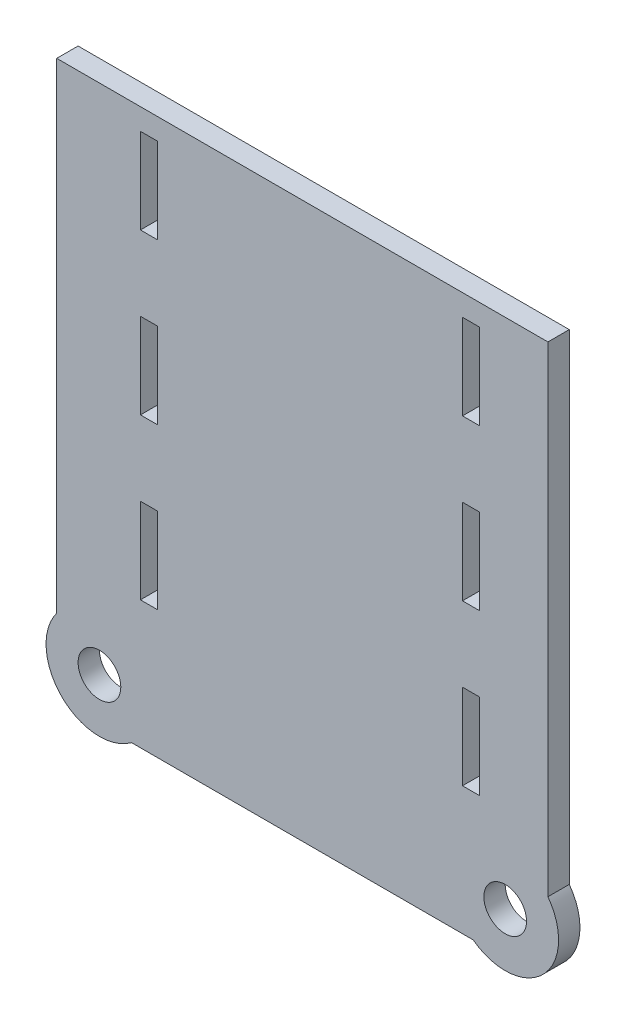
from build123d import *

# Parameters (mm, degrees)
SKETCH1_R           = 6.35
BOSS_EXTRUDE1_DEPTH = 3.175
SKETCH2_W           = 5.08
SKETCH2_H           = 25.4
CUT_EXTRUDE1_DEPTH  = 171.506664093


with BuildPart() as part:
    # Sketch1 → Boss-Extrude1 (new, symmetric)
    with BuildSketch(Plane.XY):
        with BuildLine():
            Line((-0.002676144, -12.7), (0.002676144, -12.7))
            Line((0.002676144, -12.7), (50.8, -12.7))
            ThreePointArc((50.8, -12.7), (71.550320151, -11.225320151), (73.025, 9.525))
            Line((73.025, 9.525), (73.025, 152.4))
            Line((73.025, 152.4), (-73.025, 152.4))
            Line((-73.025, 152.4), (-73.025, 9.525))
            ThreePointArc((-73.025, 9.525), (-71.550320151, -11.225320151), (-50.8, -12.7))
            Line((-50.8, -12.7), (-0.002676144, -12.7))
        make_face()
        with Locations((-60.325, 0)):
            Circle(SKETCH1_R, mode=Mode.SUBTRACT)
        with Locations((60.325, 0)):
            Circle(SKETCH1_R, mode=Mode.SUBTRACT)
    extrude(amount=BOSS_EXTRUDE1_DEPTH, both=True)

    # Sketch2 → Cut-Extrude1 (cut, through all)
    with BuildSketch(Plane.XY.offset(3.175)):
        with Locations((-45.593, 133.35)):
            Rectangle(SKETCH2_W, SKETCH2_H)
        with Locations((-45.593, 85.725)):
            Rectangle(SKETCH2_W, SKETCH2_H)
        with Locations((-45.593, 38.1)):
            Rectangle(SKETCH2_W, SKETCH2_H)
        with Locations((50.165, 133.35)):
            Rectangle(SKETCH2_W, SKETCH2_H)
        with Locations((50.165, 38.1)):
            Rectangle(SKETCH2_W, SKETCH2_H)
        with Locations((50.165, 85.725)):
            Rectangle(SKETCH2_W, SKETCH2_H)
    extrude(amount=-CUT_EXTRUDE1_DEPTH, mode=Mode.SUBTRACT)


solid = part.part
